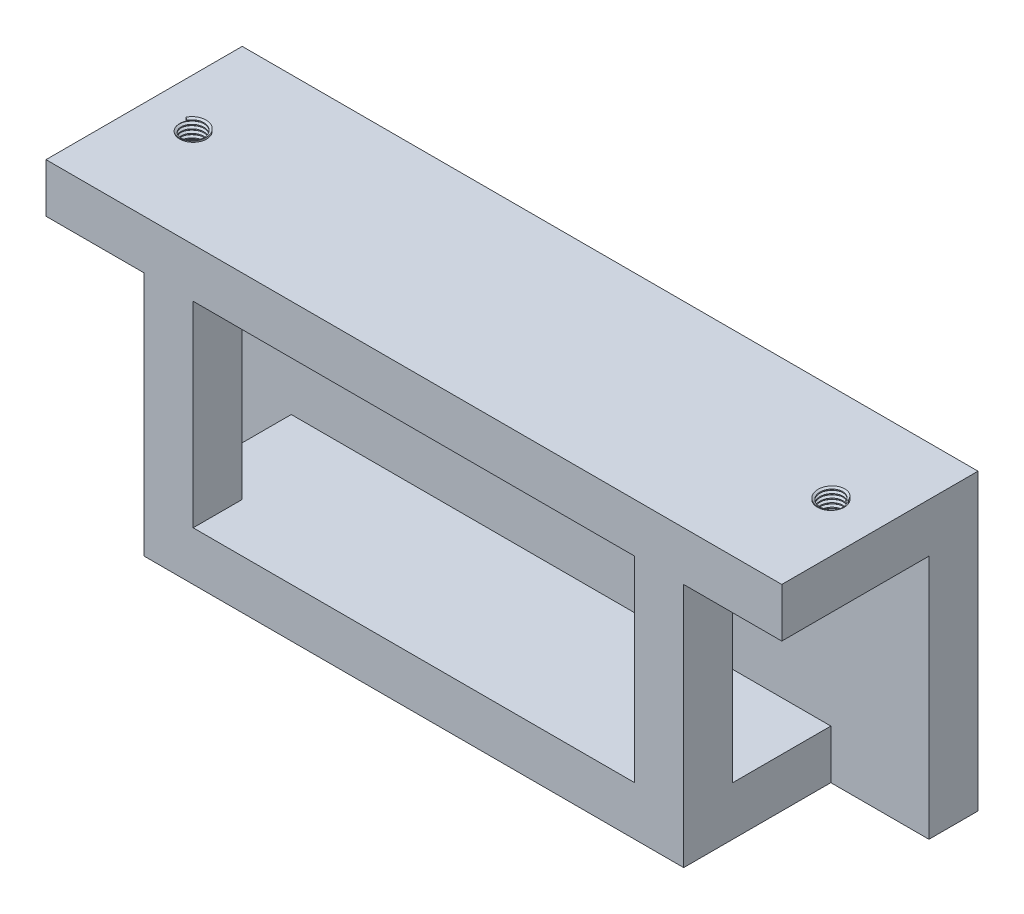
from build123d import *

# Parameters (mm, degrees)
SKETCH2_W                                       = 110
SKETCH2_H                                       = 40
BOSS_EXTRUDE2_DEPTH                             = 60
SKETCH3_W                                       = 20
SKETCH3_H                                       = 40
CUT_EXTRUDE1_DEPTH                              = 132.529464
SKETCH4_W                                       = 90
SKETCH4_H                                       = 40
CUT_EXTRUDE2_DEPTH                              = 132.529464
BOSS_EXTRUDE3_DEPTH                             = 20
BOSS_EXTRUDE3_DEPTH_BACK                        = 130
SKETCH5_W                                       = 40
SKETCH5_H                                       = 10
CSK_FOR_M5_FLAT_HEAD_MACHINE_SCREW1_D           = 5.5
CSK_FOR_M5_FLAT_HEAD_MACHINE_SCREW1_CSINK_D     = 10.4
CSK_FOR_M5_FLAT_HEAD_MACHINE_SCREW1_CSINK_ANGLE = 90
THREAD1_PITCH                                   = 0.8
SKETCH9_W                                       = 150
SKETCH9_H                                       = 10
BOSS_EXTRUDE5_DEPTH                             = 50


with BuildPart() as part:
    # Sketch2 → Boss-Extrude2 (new body)
    with BuildSketch(Plane(origin=(0, 0, 0), x_dir=(1, 0, 0), z_dir=(0, 1, 0))):
        with Locations((55, 20)):
            Rectangle(SKETCH2_W, SKETCH2_H)
    extrude(amount=BOSS_EXTRUDE2_DEPTH)

    # Sketch3 → Cut-Extrude1 (cut, through all)
    with BuildSketch(Plane(origin=(110, 0, 0), x_dir=(0, 0, -1), z_dir=(1, 0, 0))):
        with Locations((20, 30)):
            Rectangle(SKETCH3_W, SKETCH3_H)
    extrude(amount=-CUT_EXTRUDE1_DEPTH, mode=Mode.SUBTRACT)

    # Sketch4 → Cut-Extrude2 (cut, through all)
    with BuildSketch(Plane.XY):
        with Locations((55, 30)):
            Rectangle(SKETCH4_W, SKETCH4_H)
    extrude(amount=-CUT_EXTRUDE2_DEPTH, mode=Mode.SUBTRACT)

    # Sketch5 → Boss-Extrude3 (add, two sides: drawn at the far end of the back side and taken through both)
    with BuildSketch(Plane(origin=(110, 0, 0), x_dir=(0, 0, -1), z_dir=(1, 0, 0)).offset(-BOSS_EXTRUDE3_DEPTH_BACK)):
        with Locations((20, 55)):
            Rectangle(SKETCH5_W, SKETCH5_H)
    extrude(amount=BOSS_EXTRUDE3_DEPTH + BOSS_EXTRUDE3_DEPTH_BACK)

    # CSK for M5 Flat Head Machine Screw1 (through all)
    with Locations(Plane.XZ.offset(-50)):
        with Locations((120, -20), (-10, -20)):
            CounterSinkHole(CSK_FOR_M5_FLAT_HEAD_MACHINE_SCREW1_D / 2, CSK_FOR_M5_FLAT_HEAD_MACHINE_SCREW1_CSINK_D / 2, counter_sink_angle=CSK_FOR_M5_FLAT_HEAD_MACHINE_SCREW1_CSINK_ANGLE)

    # Thread1: the profile of Thread Profile1 profile screwed along a right-hand helix of 9.4375 turns, 8 arcs to a turn; built about Z, then put on its axis
    thread1_z = Axis((0, 0, 0), (0, 0, 1))
    thread1_corners = [(2.7503, 0, -0.000173), (2.7503, 0, 0.700173), (2.316987, 0, 0.45), (2.316987, 0, 0.25)]
    with BuildLine(mode=Mode.PRIVATE) as thread1_profile:
        Line(thread1_corners[0], thread1_corners[1])
        Line(thread1_corners[1], thread1_corners[2])
        Line(thread1_corners[2], thread1_corners[3])
        Line(thread1_corners[3], thread1_corners[0])
    thread1_cap = Face(thread1_profile.wire())
    thread1_turn_angles = [0, 22.5, 45, 67.5, 90, 112.5, 135, 157.5, 180, 202.5, 225, 247.5, 270, 292.5, 315, 337.5, 360]
    thread1_turn_weights = [1, 0.9238795325112867, 1, 0.9238795325112867, 1, 0.9238795325112867, 1, 0.9238795325112867, 1, 0.9238795325112867, 1, 0.9238795325112867, 1, 0.9238795325112867, 1, 0.9238795325112867, 1]
    thread1_turn_rails = [Edge.make_bspline([Vector(p[0], p[1], 0).rotate(thread1_z, thread1_turn_angles[k]) / thread1_turn_weights[k] + Vector(0, 0, p[2] + THREAD1_PITCH * thread1_turn_angles[k] / 360) for k in range(17)], [0, 0, 0, 1, 1, 2, 2, 3, 3, 4, 4, 5, 5, 6, 6, 7, 7, 8, 8, 8], 2, thread1_turn_weights) for p in thread1_corners]
    thread1_turn_sides = [Face.make_surface_from_curves(thread1_turn_rails[p[0]], thread1_turn_rails[p[1]]) for p in [(0, 1), (1, 2), (2, 3), (3, 0)]]
    thread1_last_angles = [3240, 3262.5, 3285, 3307.5, 3330, 3352.5, 3375, 3386.25, 3397.5]
    thread1_last_weights = [1, 0.9238795325112867, 1, 0.9238795325112867, 1, 0.9238795325112867, 1, 0.980785280403225, 1]
    thread1_last_rails = [Edge.make_bspline([Vector(p[0], p[1], 0).rotate(thread1_z, thread1_last_angles[k]) / thread1_last_weights[k] + Vector(0, 0, p[2] + THREAD1_PITCH * thread1_last_angles[k] / 360) for k in range(9)], [0, 0, 0, 1, 1, 2, 2, 3, 3, 4, 4, 4], 2, thread1_last_weights) for p in thread1_corners]
    thread1_last_sides = [Face.make_surface_from_curves(thread1_last_rails[p[0]], thread1_last_rails[p[1]]) for p in [(0, 1), (1, 2), (2, 3), (3, 0)]]
    thread1 = Plane(origin=(-10, 52.45, -20), x_dir=(1, 0, 0), z_dir=(0, 1, 0)) * Solid(Shell([*[p.moved(Location((0, 0, THREAD1_PITCH * i))) for i in range(9) for p in thread1_turn_sides], *thread1_last_sides, thread1_cap, thread1_cap.rotate(thread1_z, 3397.5).moved(Location((0, 0, THREAD1_PITCH * 3397.5 / 360)))]))
    add(thread1)

    # Mirror1: Thread1 across plane
    add(thread1.mirror(Plane.ZY.offset(-55)))

    # Sketch9 → Boss-Extrude5 (add)
    with BuildSketch(Plane.XZ.offset(-50)):
        with Locations((55, -35)):
            Rectangle(SKETCH9_W, SKETCH9_H)
    extrude(amount=BOSS_EXTRUDE5_DEPTH)


solid = part.part
